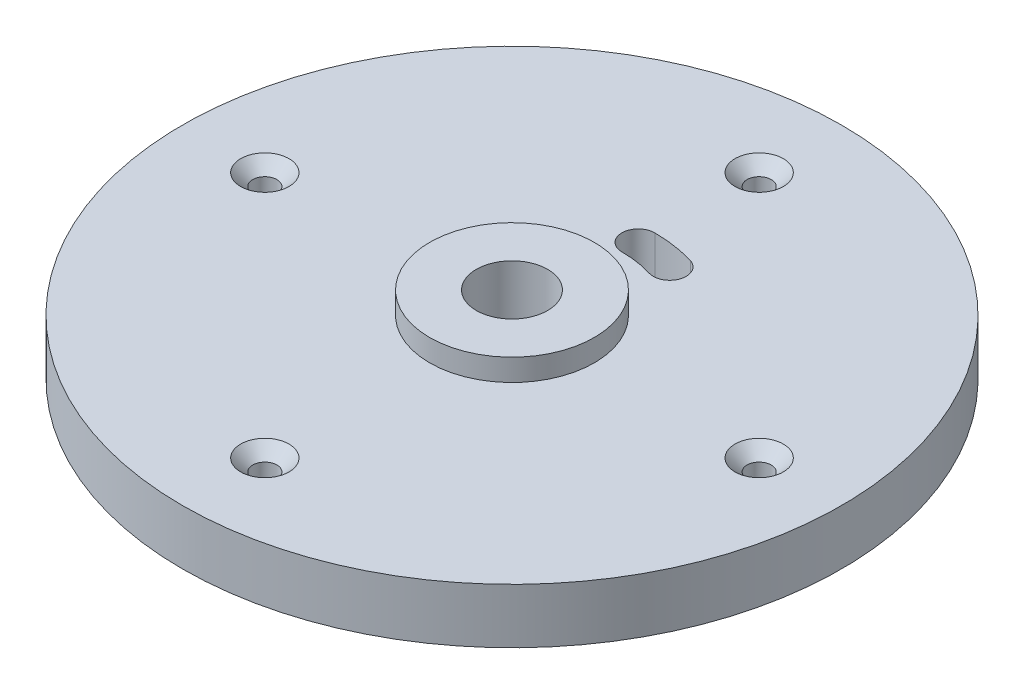
from build123d import *

# Parameters (mm, degrees)
CORTE_EXTRUS_O3_REACH         = 46.677
RESSALTO_EXTRUS_O1_DEPTH      = 2
RESSALTO_EXTRUS_O1_DEPTH_BACK = 7.7
ESBO_O4_R                     = 7.5
ESBO_O4_R_2                   = 3.25


# Read off the part's stored shape, not the designer's step: PadrãoCircular1
with BuildPart() as part:
    # Esboço1 → Revolução1 (revolve)
    with BuildSketch(Plane.XY, mode=Mode.PRIVATE) as revolu_o1_sk:
        Polygon((3.25, 14), (3.25, 11.5), (5, 11.5), (5, 6.3), (15, 6.3), (15, 9), (30, 9), (30, 14), align=None)
    revolve(revolu_o1_sk.sketch.rotate(Axis((0, 0, 0), (0, 1, 0)), 90), axis=Axis((0, 0, 0), (0, 1, 0)))

    # Esboço2 → Corte-extrusão3 (cut, up to next)
    with BuildSketch(Plane(origin=(0, 0, 0), x_dir=(1, 0, 0), z_dir=(0, 1, 0)), mode=Mode.PRIVATE) as corte_extrus_o3_sk1:
        with BuildLine():
            ThreePointArc((2.923717047, 9.56304756), (1.478094111, 9.890158634), (0, 10))
            ThreePointArc((0, 10), (-1.5, 11.5), (0, 13))
            ThreePointArc((0, 13), (1.921522345, 12.857206224), (3.800832161, 12.431961828))
            ThreePointArc((3.800832161, 12.431961828), (4.796731738, 10.558947136), (2.923717047, 9.56304756))
        make_face()
    corte_extrus_o3_tool1 = extrude(corte_extrus_o3_sk1.sketch, amount=CORTE_EXTRUS_O3_REACH, mode=Mode.PRIVATE) & part.part
    add(corte_extrus_o3_tool1.solids().sort_by_distance((1.688498, 0, -11.298001))[0], mode=Mode.SUBTRACT)

    # Esboço4 → Ressalto-extrusão1 (add, two sides: drawn at the far end of the back side and taken through both)
    with BuildSketch(Plane(origin=(0, 14, 0), x_dir=(1, 0, 0), z_dir=(0, 1, 0)).offset(-RESSALTO_EXTRUS_O1_DEPTH_BACK)):
        with Locations(Location((0, 0, 0), (0, 0, 270))):
            Circle(ESBO_O4_R)
        with Locations(Location((0, 0, 0), (0, 0, 270))):
            Circle(ESBO_O4_R_2, mode=Mode.SUBTRACT)
    extrude(amount=RESSALTO_EXTRUS_O1_DEPTH + RESSALTO_EXTRUS_O1_DEPTH_BACK)

    # Esboço10 → Escareado para parafuso de máquina com cabeça chata de M21 (revolve, cut)
    with BuildSketch(Plane(origin=(0, 14, -22.5), x_dir=(0, 0, 1), z_dir=(1, 0, 0))):
        Polygon((0, 0), (0, 5.660946681), (1.1, 5), (1.1, 1.1), (2.2, 0), align=None)
    revolve(axis=Axis((0, 20.35, -22.5), (0, -1, 0)), mode=Mode.SUBTRACT)

    # PadrãoCircular1 outline → PadrãoCircular1 (revolve, cut)
    with BuildSketch(Plane(origin=(22.5, 0, 0), x_dir=(1, 0, 0), z_dir=(0, 0, 1))):
        Polygon((0, 9), (1.1, 9), (1.1, 12.9), (2.2, 14), (0, 14), align=None)
    revolve(axis=Axis((22.5, 0, 0), (0, 1, 0)), mode=Mode.SUBTRACT)

    # Padr_oCircular1 2 outline → Padr_oCircular1 2 (revolve, cut)
    with BuildSketch(Plane.XY.offset(22.5)):
        Polygon((0, 9), (1.1, 9), (1.1, 12.9), (2.2, 14), (0, 14), align=None)
    revolve(axis=Axis((0, 0, 22.5), (0, 1, 0)), mode=Mode.SUBTRACT)

    # Padr_oCircular1 3 outline → Padr_oCircular1 3 (revolve, cut)
    with BuildSketch(Plane(origin=(-22.5, 0, 0), x_dir=(1, 0, 0), z_dir=(0, 0, 1))):
        Polygon((0, 9), (1.1, 9), (1.1, 12.9), (2.2, 14), (0, 14), align=None)
    revolve(axis=Axis((-22.5, 0, 0), (0, 1, 0)), mode=Mode.SUBTRACT)


solid = part.part
